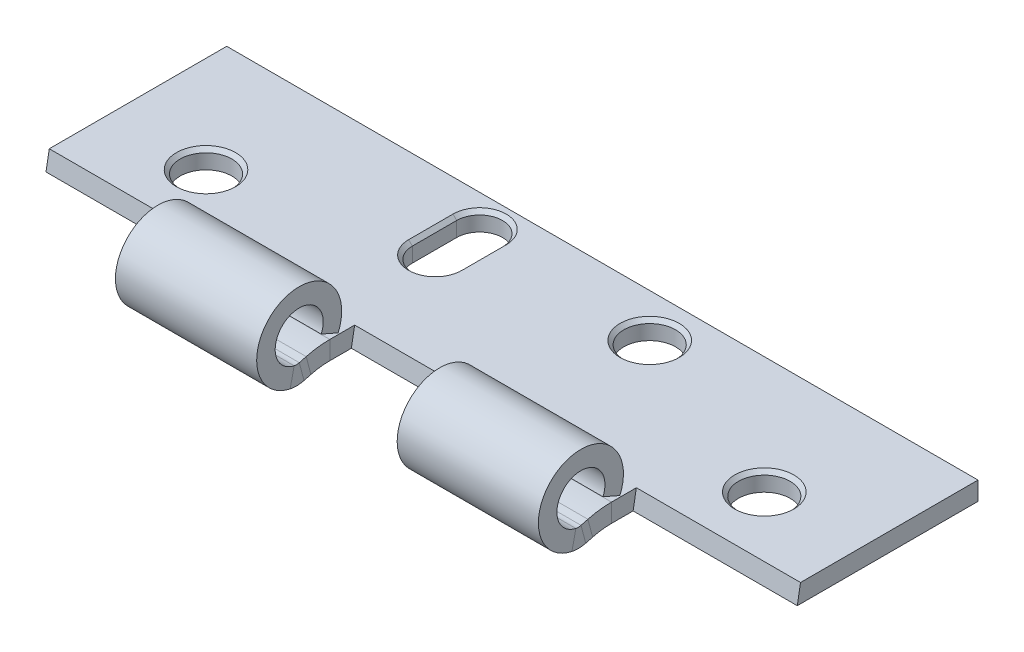
from build123d import *

# Parameters (mm, degrees)
BASE_FLANGE1_DEPTH           = 50.8
CUT_EXTRUDE1_DEPTH           = 61.049583679
CUT_EXTRUDE1_DEPTH_BACK      = 61.049583679
SKETCH6_W                    = 22.2
SKETCH6_H                    = 40.396012785
SKETCH6_W_2                  = 19
F_7_0_7_DIAMETER_HOLE1_D     = 7
F_7_0_7_DIAMETER_HOLE1_DEPTH = 10
F_7_0_7_DIAMETER_HOLE1_TIP   = 2.103012167
CUT_EXTRUDE2_DEPTH           = 10
CHAMFER1_SIZE                = 0.5
CHAMFER2_SIZE                = 0.5
CHAMFER2_SIZE_2              = 2.83564091


# Sheet-metal steps are written as plain solids
with BuildPart() as part:
    # Sketch1 → Base-Flange1 (new, symmetric)
    with BuildSketch(Plane(origin=(0, 0, 0), x_dir=(0, 0, -1), z_dir=(1, 0, 0))):
        with BuildLine():
            Line((31.5, -5), (4.137865616, -5))
            ThreePointArc((4.137865616, -5), (2.850262482, -5.083242558), (1.584096024, -5.331584366))
            Line((1.584096024, -5.331584366), (0.651734752, -5.577853864))
            ThreePointArc((0.651734752, -5.577853864), (-0.279113067, -5.709460074), (-1.214968707, -5.620173577))
            ThreePointArc((-1.214968707, -5.620173577), (-2.620425709, 5.118190022), (5.269962049, -2.3))
            Line((5.269962049, -2.3), (2.978674202, -1.3))
            ThreePointArc((2.978674202, -1.3), (-1.481110183, 2.892890013), (-0.686721443, -3.176619848))
            ThreePointArc((-0.686721443, -3.176619848), (-0.335775578, -3.210102284), (0.013292354, -3.160749956))
            Line((0.013292354, -3.160749956), (0.945653625, -2.914480458))
            ThreePointArc((0.945653625, -2.914480458), (2.528361698, -2.604053197), (4.137865616, -2.5))
            Line((4.137865616, -2.5), (31.5, -2.5))
            Line((31.5, -2.5), (31.5, -5))
        make_face()
    extrude(amount=BASE_FLANGE1_DEPTH, both=True)

    # Sketch6 → Cut-Extrude1 (cut, two sides: drawn at the far end of the back side and taken through both)
    with BuildSketch(Plane(origin=(0, 0, 0), x_dir=(1, 0, 0), z_dir=(0, 1, 0)).offset(-CUT_EXTRUDE1_DEPTH_BACK)):
        with Locations((-39.7, -13.198006393)):
            Rectangle(SKETCH6_W, SKETCH6_H)
        with Locations((39.7, -13.198006393)):
            Rectangle(SKETCH6_W, SKETCH6_H)
        with Locations((0, -13.198006393)):
            Rectangle(SKETCH6_W_2, SKETCH6_H)
    extrude(amount=CUT_EXTRUDE1_DEPTH + CUT_EXTRUDE1_DEPTH_BACK, mode=Mode.SUBTRACT)

    # Ø7.0 (7) Diameter Hole1
    with Locations(Plane(origin=(0, -2.5, 0), x_dir=(1, 0, 0), z_dir=(0, 1, 0))):
        with Locations((37.75, 15.65), (-37.75, 15.65), (12.25, 25.65)):
            Hole(F_7_0_7_DIAMETER_HOLE1_D / 2, depth=F_7_0_7_DIAMETER_HOLE1_DEPTH)
            with Locations((0, 0, -(F_7_0_7_DIAMETER_HOLE1_DEPTH + F_7_0_7_DIAMETER_HOLE1_TIP / 2))):  # 118° drill point
                Cone(0, F_7_0_7_DIAMETER_HOLE1_D / 2, F_7_0_7_DIAMETER_HOLE1_TIP, mode=Mode.SUBTRACT)

    # Sketch9 → Cut-Extrude2 (cut)
    with BuildSketch(Plane(origin=(0, -2.5, 0), x_dir=(1, 0, 0), z_dir=(0, 1, 0))):
        with BuildLine():
            Line((-9.15, 27.15), (-9.15, 21.15))
            ThreePointArc((-9.15, 21.15), (-12.25, 18.05), (-15.35, 21.15))
            Line((-15.35, 21.15), (-15.35, 27.15))
            ThreePointArc((-15.35, 27.15), (-12.25, 30.25), (-9.15, 27.15))
        make_face()
    extrude(amount=-CUT_EXTRUDE2_DEPTH, mode=Mode.SUBTRACT)

    # Chamfer1
    chamfer1_edges = [part.edges().sort_by_distance(p)[0] for p in [
        (15.75, -2.5, -25.65),
        (-34.25, -2.5, -15.65),
        (41.25, -2.5, -15.65),
        (-12.25, -2.5, -30.25),
        (-15.35, -2.5, -24.15),
        (-12.25, -2.5, -18.05),
        (-9.15, -2.5, -24.15),
    ]]
    chamfer(chamfer1_edges, length=CHAMFER1_SIZE)

    # Chamfer2
    # the kernel refuses this chamfer: 2.83564091, 0.5 mm, written as the material it takes off along each edge
    with BuildSketch(Plane(origin=(-28.6, -2.5, -7), x_dir=(0, 0.21013876076743535, -0.9776715712462578), z_dir=(-1, 0, 0))) as chamfer2_piece_1:
        Polygon((CHAMFER2_SIZE * 0.977671571246, CHAMFER2_SIZE * 0.210138760767), (-CHAMFER2_SIZE_2 * 0.210138760753, CHAMFER2_SIZE_2 * 0.97767157118), (0, 0), align=None)
    extrude(amount=29.568522917, mode=Mode.SUBTRACT)
    with BuildSketch(Plane(origin=(-9.5, -2.5, -7), x_dir=(0, 0.21013876076743535, -0.9776715712462578), z_dir=(1, 0, 0))) as chamfer2_piece_2:
        Polygon((CHAMFER2_SIZE * 0.977671571246, -CHAMFER2_SIZE * 0.210138760767), (-CHAMFER2_SIZE_2 * 0.210138760753, -CHAMFER2_SIZE_2 * 0.97767157118), (0, 0), align=None)
    extrude(amount=19, mode=Mode.SUBTRACT)
    with BuildSketch(Plane(origin=(28.6, -2.5, -7), x_dir=(0, 0.21013876076743535, -0.9776715712462578), z_dir=(1, 0, 0))) as chamfer2_piece_3:
        Polygon((CHAMFER2_SIZE * 0.977671571246, -CHAMFER2_SIZE * 0.210138760767), (-CHAMFER2_SIZE_2 * 0.210138760753, -CHAMFER2_SIZE_2 * 0.97767157118), (0, 0), align=None)
    extrude(amount=29.568522917, mode=Mode.SUBTRACT)


solid = part.part
